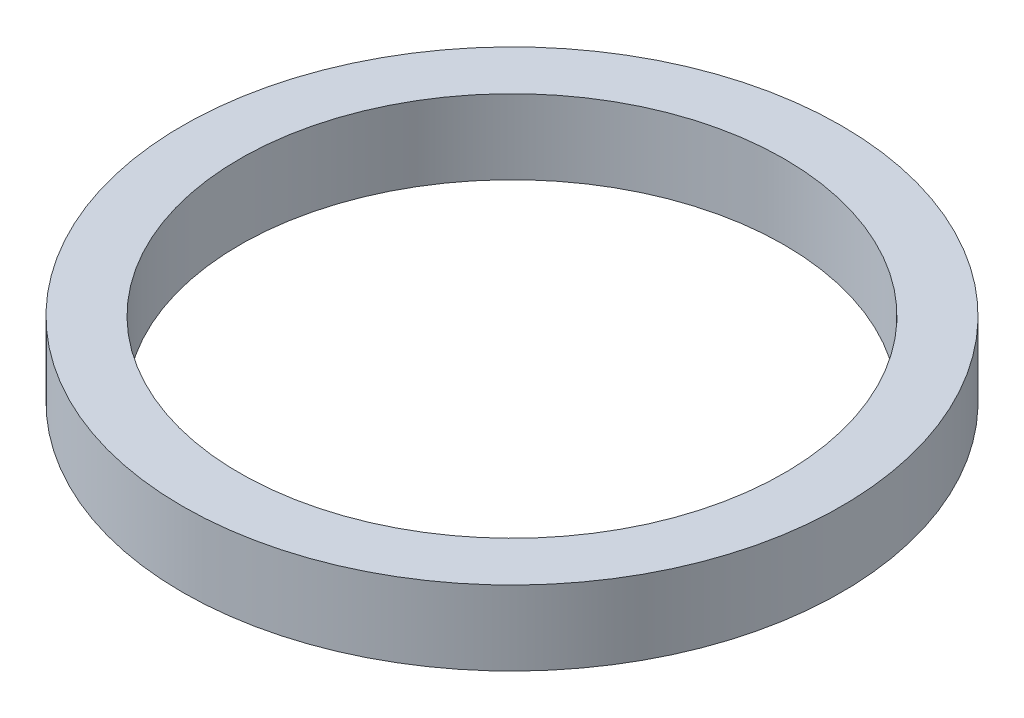
from build123d import *

# Parameters (mm, degrees)
SKETCH1_R           = 57.5
BOSS_EXTRUDE1_DEPTH = 13
SKETCH2_R           = 47.5
CUT_EXTRUDE1_DEPTH  = 83.349863388


with BuildPart() as part:
    # Sketch1 → Boss-Extrude1 (new body)
    with BuildSketch(Plane(origin=(0, 0, 0), x_dir=(1, 0, 0), z_dir=(0, 1, 0))):
        Circle(SKETCH1_R)
    extrude(amount=BOSS_EXTRUDE1_DEPTH)

    # Sketch2 → Cut-Extrude1 (cut, through all)
    with BuildSketch(Plane(origin=(0, 0, 0), x_dir=(1, 0, 0), z_dir=(0, 1, 0))):
        Circle(SKETCH2_R)
    extrude(amount=CUT_EXTRUDE1_DEPTH, mode=Mode.SUBTRACT)


solid = part.part
